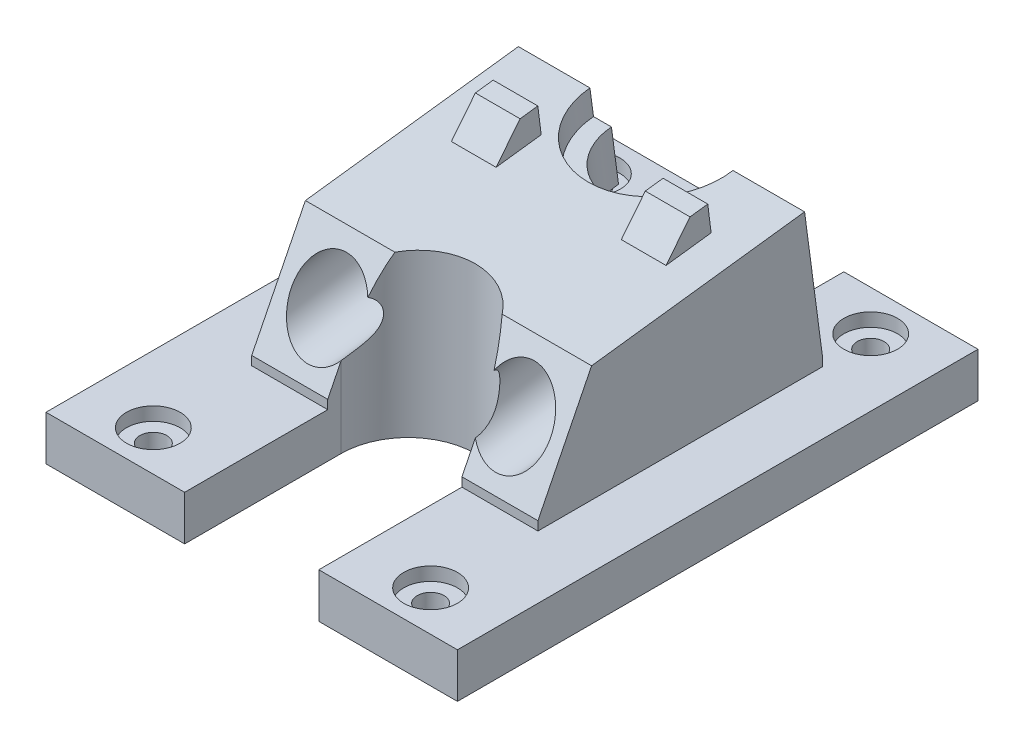
from build123d import *
from build123d.topology import SkipClean

# Parameters (mm, degrees)
SKETCH1_R           = 3
SKETCH1_R_2         = 1.5
BOSS_EXTRUDE1_DEPTH = 5
CUT_EXTRUDE1_START  = 3.5
SKETCH1_3_R         = 3
SKETCH1_3_R_2       = 1.5
CUT_EXTRUDE1_DEPTH  = 1.5
BOSS_EXTRUDE2_DEPTH = 16
BOSS_EXTRUDE3_START = 7
BOSS_EXTRUDE3_DEPTH = 5
SKETCH3_R           = 1.75
CUT_EXTRUDE2_DEPTH  = 58.304165422
CUT_EXTRUDE3_START  = -14
SKETCH3_3_R         = 2.5
SKETCH3_3_R_2       = 1.75
CUT_EXTRUDE3_DEPTH  = 44.304165422
CUT_EXTRUDE4_START  = -19
SKETCH3_4_R         = 4
SKETCH3_4_R_2       = 2.5
CUT_EXTRUDE4_DEPTH  = 39.304165422
CUT_EXTRUDE5_DEPTH  = 44.730761674
CUT_EXTRUDE6_DEPTH  = 3
CUT_EXTRUDE7_START  = 3
CUT_EXTRUDE7_DEPTH  = 6
CUT_EXTRUDE8_START  = 9
CUT_EXTRUDE8_DEPTH  = 12.133821


with BuildPart() as part:
    # Sketch1 → Boss-Extrude1 (new body)
    # profile 1 of 5: a face of its own
    with BuildSketch(Plane(origin=(0, 0, 0), x_dir=(1, 0, 0), z_dir=(0, 1, 0))):
        with BuildLine():
            ThreePointArc((7.5, -11.6), (0, -4.1), (-7.5, -11.6))
            Line((-7.5, -11.6), (-7.5, -29.1))
            Line((-7.5, -29.1), (-23, -29.1))
            Line((-23, -29.1), (-23, 29.1))
            Line((-23, 29.1), (-8, 29.1))
            Line((-8, 29.1), (-8, 19.1))
            ThreePointArc((-8, 19.1), (0, 11.1), (8, 19.1))
            Line((8, 19.1), (8, 29.1))
            Line((8, 29.1), (23, 29.1))
            Line((23, 29.1), (23, -29.1))
            Line((23, -29.1), (7.5, -29.1))
            Line((7.5, -29.1), (7.5, -11.6))
        make_face()
        with Locations((15.5, -24.6)):
            Circle(SKETCH1_R, mode=Mode.SUBTRACT)
        with Locations((-15.5, 24.6)):
            Circle(SKETCH1_R, mode=Mode.SUBTRACT)
        with Locations((-15.5, -24.6)):
            Circle(SKETCH1_R, mode=Mode.SUBTRACT)
        with Locations((15.5, 24.6)):
            Circle(SKETCH1_R, mode=Mode.SUBTRACT)
    # profile 2 of 5: a face of its own
    with BuildSketch(Plane(origin=(0, 0, 0), x_dir=(1, 0, 0), z_dir=(0, 1, 0))):
        with Locations((-15.5, -24.6)):
            Circle(SKETCH1_R)
        with Locations(Location((-15.5, -24.6, 0), (0, 0, 270))):
            Circle(SKETCH1_R_2, mode=Mode.SUBTRACT)
    # profile 3 of 5: a face of its own
    with BuildSketch(Plane(origin=(0, 0, 0), x_dir=(1, 0, 0), z_dir=(0, 1, 0))):
        with Locations((15.5, -24.6)):
            Circle(SKETCH1_R)
        with Locations(Location((15.5, -24.6, 0), (0, 0, 270))):
            Circle(SKETCH1_R_2, mode=Mode.SUBTRACT)
    # profile 4 of 5: a face of its own
    with BuildSketch(Plane(origin=(0, 0, 0), x_dir=(1, 0, 0), z_dir=(0, 1, 0))):
        with Locations((15.5, 24.6)):
            Circle(SKETCH1_R)
        with Locations(Location((15.5, 24.6, 0), (0, 0, 270))):
            Circle(SKETCH1_R_2, mode=Mode.SUBTRACT)
    # profile 5 of 5: a face of its own
    with BuildSketch(Plane(origin=(0, 0, 0), x_dir=(1, 0, 0), z_dir=(0, 1, 0))):
        with Locations((-15.5, 24.6)):
            Circle(SKETCH1_R)
        with Locations(Location((-15.5, 24.6, 0), (0, 0, 270))):
            Circle(SKETCH1_R_2, mode=Mode.SUBTRACT)
    extrude(amount=BOSS_EXTRUDE1_DEPTH)

    # Sketch1<3> → Cut-Extrude1 (cut)
    # profile 1 of 4: a face of its own
    with BuildSketch(Plane(origin=(0, 0, 0), x_dir=(1, 0, 0), z_dir=(0, 1, 0)).offset(CUT_EXTRUDE1_START)):
        with Locations(Location((-15.5, -24.6, 0), (0, 0, 270))):
            Circle(SKETCH1_3_R)
        with Locations(Location((-15.5, -24.6, 0), (0, 0, 270))):
            Circle(SKETCH1_3_R_2, mode=Mode.SUBTRACT)
    # profile 2 of 4: a face of its own
    with BuildSketch(Plane(origin=(0, 0, 0), x_dir=(1, 0, 0), z_dir=(0, 1, 0)).offset(CUT_EXTRUDE1_START)):
        with Locations(Location((15.5, -24.6, 0), (0, 0, 270))):
            Circle(SKETCH1_3_R)
        with Locations(Location((15.5, -24.6, 0), (0, 0, 270))):
            Circle(SKETCH1_3_R_2, mode=Mode.SUBTRACT)
    # profile 3 of 4: a face of its own
    with BuildSketch(Plane(origin=(0, 0, 0), x_dir=(1, 0, 0), z_dir=(0, 1, 0)).offset(CUT_EXTRUDE1_START)):
        with Locations(Location((15.5, 24.6, 0), (0, 0, 270))):
            Circle(SKETCH1_3_R)
        with Locations(Location((15.5, 24.6, 0), (0, 0, 270))):
            Circle(SKETCH1_3_R_2, mode=Mode.SUBTRACT)
    # profile 4 of 4: a face of its own
    with BuildSketch(Plane(origin=(0, 0, 0), x_dir=(1, 0, 0), z_dir=(0, 1, 0)).offset(CUT_EXTRUDE1_START)):
        with Locations(Location((-15.5, 24.6, 0), (0, 0, 270))):
            Circle(SKETCH1_3_R)
        with Locations(Location((-15.5, 24.6, 0), (0, 0, 270))):
            Circle(SKETCH1_3_R_2, mode=Mode.SUBTRACT)
    extrude(amount=CUT_EXTRUDE1_DEPTH, mode=Mode.SUBTRACT)

    # Sketch2 → Boss-Extrude2 (add, symmetric)
    with BuildSketch(Plane(origin=(0, 0, 0), x_dir=(0, 0, -1), z_dir=(1, 0, 0))):
        Polygon((-13.1, 6), (-13.1, 5), (18.7117618, 5), (18.7117618, 6), (16.7117618, 21), (-7.1, 18), align=None)
    extrude(amount=BOSS_EXTRUDE2_DEPTH, both=True)

    # Sketch2<3> → Boss-Extrude3 (add)
    with BuildSketch(Plane(origin=(0, 0, 0), x_dir=(0, 0, -1), z_dir=(1, 0, 0)).offset(BOSS_EXTRUDE3_START)):
        Polygon((7.903429496, 22.913970225), (5.222006954, 19.552426955), (10.262742979, 20.1875), (9.887742979, 23.163970225), align=None)
    boss_extrude3 = extrude(amount=BOSS_EXTRUDE3_DEPTH)

    # Mirror1: Boss-Extrude3 across plane
    add(boss_extrude3.mirror(Plane(origin=(0, 0, 0), x_dir=(0, 0, 1), z_dir=(1, 0, 0))))

    # Sketch3 → Cut-Extrude2 (cut, through all)
    with BuildSketch(Plane(origin=(0, 2.556126, -19.170945), x_dir=(-1, 0, 0), z_dir=(0, 0.13216372009101815, -0.9912279006826348))):
        with Locations(Location((10.5, 13.107097306, 0), (0, 0, 90))):
            Circle(SKETCH3_R)
        with Locations(Location((-10.5, 13.107097306, 0), (0, 0, 90))):
            Circle(SKETCH3_R)
    extrude(amount=-CUT_EXTRUDE2_DEPTH, mode=Mode.SUBTRACT)

    # Sketch3<3> → Cut-Extrude3 (cut, through all)
    # profile 1 of 2: a face of its own
    with BuildSketch(Plane(origin=(0, 2.556126, -19.170945), x_dir=(-1, 0, 0), z_dir=(0, 0.13216372009101815, -0.9912279006826348)).offset(CUT_EXTRUDE3_START)):
        with Locations(Location((10.5, 13.107097306, 0), (0, 0, 90))):
            Circle(SKETCH3_3_R)
        with Locations(Location((10.5, 13.107097306, 0), (0, 0, 90))):
            Circle(SKETCH3_3_R_2, mode=Mode.SUBTRACT)
    # profile 2 of 2: a face of its own
    with BuildSketch(Plane(origin=(0, 2.556126, -19.170945), x_dir=(-1, 0, 0), z_dir=(0, 0.13216372009101815, -0.9912279006826348)).offset(CUT_EXTRUDE3_START)):
        with Locations(Location((-10.5, 13.107097306, 0), (0, 0, 90))):
            Circle(SKETCH3_3_R)
        with Locations(Location((-10.5, 13.107097306, 0), (0, 0, 90))):
            Circle(SKETCH3_3_R_2, mode=Mode.SUBTRACT)
    extrude(amount=-CUT_EXTRUDE3_DEPTH, mode=Mode.SUBTRACT)

    # Sketch3<4> → Cut-Extrude4 (cut, through all)
    # profile 1 of 2: a face of its own
    with BuildSketch(Plane(origin=(0, 2.556126, -19.170945), x_dir=(-1, 0, 0), z_dir=(0, 0.13216372009101815, -0.9912279006826348)).offset(CUT_EXTRUDE4_START)):
        with Locations(Location((10.5, 13.107097306, 0), (0, 0, 90))):
            Circle(SKETCH3_4_R)
        with Locations(Location((10.5, 13.107097306, 0), (0, 0, 90))):
            Circle(SKETCH3_4_R_2, mode=Mode.SUBTRACT)
    # profile 2 of 2: a face of its own
    with BuildSketch(Plane(origin=(0, 2.556126, -19.170945), x_dir=(-1, 0, 0), z_dir=(0, 0.13216372009101815, -0.9912279006826348)).offset(CUT_EXTRUDE4_START)):
        with Locations(Location((-10.5, 13.107097306, 0), (0, 0, 90))):
            Circle(SKETCH3_4_R)
        with Locations(Location((-10.5, 13.107097306, 0), (0, 0, 90))):
            Circle(SKETCH3_4_R_2, mode=Mode.SUBTRACT)
    extrude(amount=-CUT_EXTRUDE4_DEPTH, mode=Mode.SUBTRACT)

    # Sketch1<4> → Cut-Extrude5 (cut, through all)
    with SkipClean():  # the faces are left unmerged after this step: merging them gives an invalid solid
        with BuildSketch(Plane(origin=(0, 0, 0), x_dir=(1, 0, 0), z_dir=(0, 1, 0))):
            with BuildLine():
                Line((7.5, -11.6), (7.5, -29.1))
                Line((7.5, -29.1), (-7.5, -29.1))
                Line((-7.5, -29.1), (-7.5, -11.6))
                ThreePointArc((-7.5, -11.6), (0, -4.1), (7.5, -11.6))
            make_face()
        extrude(amount=CUT_EXTRUDE5_DEPTH, mode=Mode.SUBTRACT)
    add(part.part.scale(1), mode=Mode.REPLACE)  # the faces are merged on a copy

    # Sketch4 → Cut-Extrude6 (cut)
    with BuildSketch(Plane(origin=(0, 18.74632135, 1.176257932), x_dir=(1, 0, 0), z_dir=(0, -0.9921567416492215, -0.12499999999999996))):
        with BuildLine():
            Line((5.994557793, -18.029429203), (-5.994557793, -18.029429203))
            ThreePointArc((-5.994557793, -18.029429203), (0, -23.773935834), (5.994557793, -18.029429203))
        make_face()
        with BuildLine():
            ThreePointArc((6, -17.773935834), (-0.127775662, -11.77529654), (-5.994557793, -18.029429203))
            Line((-5.994557793, -18.029429203), (5.994557793, -18.029429203))
            ThreePointArc((5.994557793, -18.029429203), (5.998639294, -17.901711496), (6, -17.773935834))
        make_face()
        with BuildLine():
            ThreePointArc((7.995919155, -18.029429203), (7.998979724, -17.901698812), (8, -17.773935834))
            ThreePointArc((8, -17.773935834), (-0.127762979, -9.77495611), (-7.995919155, -18.029429203))
            Line((-7.995919155, -18.029429203), (-5.994557793, -18.029429203))
            ThreePointArc((-5.994557793, -18.029429203), (-0.127775662, -11.77529654), (6, -17.773935834))
            ThreePointArc((6, -17.773935834), (5.998639294, -17.901711496), (5.994557793, -18.029429203))
            Line((5.994557793, -18.029429203), (7.995919155, -18.029429203))
        make_face()
        with BuildLine():
            Line((-5.994557793, -18.029429203), (-7.995919155, -18.029429203))
            ThreePointArc((-7.995919155, -18.029429203), (0, -25.773935834), (7.995919155, -18.029429203))
            Line((7.995919155, -18.029429203), (5.994557793, -18.029429203))
            ThreePointArc((5.994557793, -18.029429203), (0, -23.773935834), (-5.994557793, -18.029429203))
        make_face()
    extrude(amount=CUT_EXTRUDE6_DEPTH, mode=Mode.SUBTRACT)

    # Sketch4<3> → Cut-Extrude7 (cut)
    with BuildSketch(Plane(origin=(0, 18.74632135, 1.176257932), x_dir=(1, 0, 0), z_dir=(0, -0.9921567416492215, -0.12499999999999996)).offset(CUT_EXTRUDE7_START)):
        with BuildLine():
            Line((5.994557793, -18.029429203), (-5.994557793, -18.029429203))
            ThreePointArc((-5.994557793, -18.029429203), (0, -23.773935834), (5.994557793, -18.029429203))
        make_face()
        with BuildLine():
            ThreePointArc((6, -17.773935834), (-0.127775662, -11.77529654), (-5.994557793, -18.029429203))
            Line((-5.994557793, -18.029429203), (5.994557793, -18.029429203))
            ThreePointArc((5.994557793, -18.029429203), (5.998639294, -17.901711496), (6, -17.773935834))
        make_face()
    extrude(amount=CUT_EXTRUDE7_DEPTH, mode=Mode.SUBTRACT)

    # Sketch4<4> → Cut-Extrude8 (cut)
    with BuildSketch(Plane(origin=(0, 18.74632135, 1.176257932), x_dir=(1, 0, 0), z_dir=(0, -0.9921567416492215, -0.12499999999999996)).offset(CUT_EXTRUDE8_START)):
        with BuildLine():
            Line((5.994557793, -18.029429203), (-5.994557793, -18.029429203))
            ThreePointArc((-5.994557793, -18.029429203), (0, -23.773935834), (5.994557793, -18.029429203))
        make_face()
        with BuildLine():
            ThreePointArc((6, -17.773935834), (-0.127775662, -11.77529654), (-5.994557793, -18.029429203))
            Line((-5.994557793, -18.029429203), (5.994557793, -18.029429203))
            ThreePointArc((5.994557793, -18.029429203), (5.998639294, -17.901711496), (6, -17.773935834))
        make_face()
        with BuildLine():
            ThreePointArc((7.995919155, -18.029429203), (7.998979724, -17.901698812), (8, -17.773935834))
            ThreePointArc((8, -17.773935834), (-0.127762979, -9.77495611), (-7.995919155, -18.029429203))
            Line((-7.995919155, -18.029429203), (-5.994557793, -18.029429203))
            ThreePointArc((-5.994557793, -18.029429203), (-0.127775662, -11.77529654), (6, -17.773935834))
            ThreePointArc((6, -17.773935834), (5.998639294, -17.901711496), (5.994557793, -18.029429203))
            Line((5.994557793, -18.029429203), (7.995919155, -18.029429203))
        make_face()
        with BuildLine():
            Line((-5.994557793, -18.029429203), (-7.995919155, -18.029429203))
            ThreePointArc((-7.995919155, -18.029429203), (0, -25.773935834), (7.995919155, -18.029429203))
            Line((7.995919155, -18.029429203), (5.994557793, -18.029429203))
            ThreePointArc((5.994557793, -18.029429203), (0, -23.773935834), (-5.994557793, -18.029429203))
        make_face()
    extrude(amount=CUT_EXTRUDE8_DEPTH, mode=Mode.SUBTRACT)


solid = part.part
